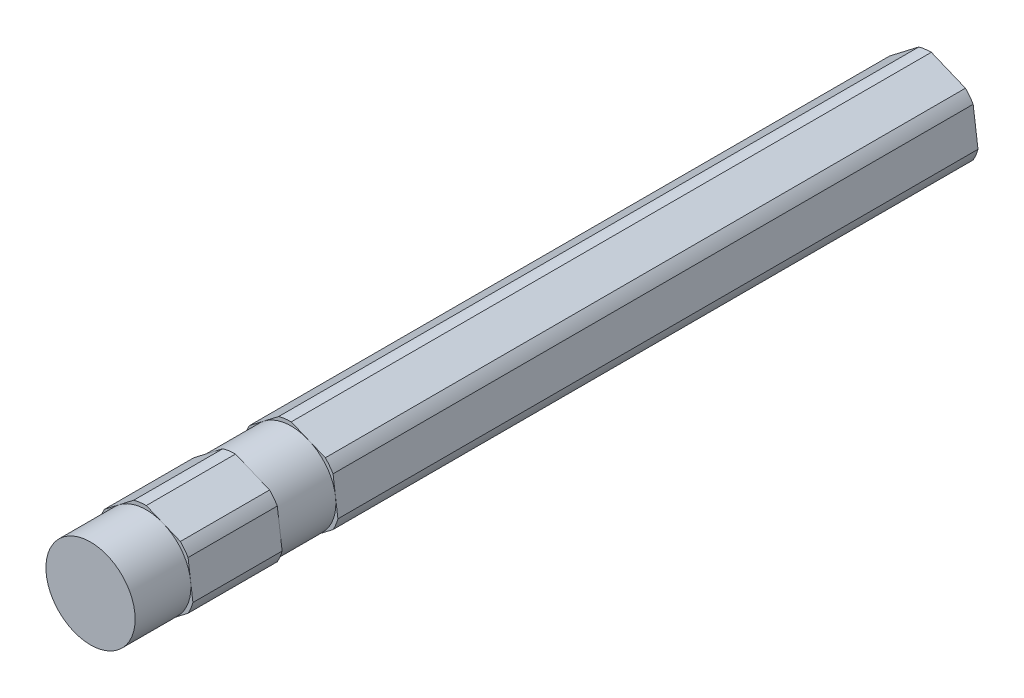
from build123d import *

# Parameters (mm, degrees)
BOSS_EXTRUDE1_DEPTH         = 119.6975
F_1_4_20_TAPPED_HOLE2_D     = 5.1054
F_1_4_20_TAPPED_HOLE2_DEPTH = 16.51
F_1_4_20_TAPPED_HOLE2_TIP   = 1.533816902
CUT_EXTRUDE1_START          = -7.9375
CUT_EXTRUDE1_DEPTH          = 7.9375
CUT_EXTRUDE3_START          = -7.9375
CUT_EXTRUDE3_DEPTH          = 7.9375


with BuildPart() as part:
    # Sketch1 → Boss-Extrude1 (new body)
    with BuildSketch(Plane.XY):
        with BuildLine():
            Line((-1.789892893, 6.63346078), (-5.950200742, 3.43535))
            ThreePointArc((-5.950200742, 3.43535), (-6.35, 2.623741315), (-6.639691997, 1.766637675))
            Line((-6.639691997, 1.766637675), (-5.950200742, -3.43535))
            ThreePointArc((-5.950200742, -3.43535), (-5.447226632, -4.187390656), (-4.849799104, -4.866823105))
            Line((-4.849799104, -4.866823105), (0, -6.8707))
            ThreePointArc((0, -6.8707), (0.902773368, -6.811131972), (1.789892893, -6.63346078))
            Line((1.789892893, -6.63346078), (5.950200742, -3.43535))
            ThreePointArc((5.950200742, -3.43535), (6.35, -2.623741315), (6.639691997, -1.766637675))
            Line((6.639691997, -1.766637675), (5.950200742, 3.43535))
            ThreePointArc((5.950200742, 3.43535), (5.447226632, 4.187390656), (4.849799104, 4.866823105))
            Line((4.849799104, 4.866823105), (0, 6.8707))
            ThreePointArc((0, 6.8707), (-0.902773368, 6.811131972), (-1.789892893, 6.63346078))
        make_face()
    extrude(amount=BOSS_EXTRUDE1_DEPTH)

    # 1/4-20 Tapped Hole2
    with Locations(Plane(origin=(0, 0, 0), x_dir=(-1, 0, 0), z_dir=(0, 0, -1))):
        with Locations((0, 0)):
            Hole(F_1_4_20_TAPPED_HOLE2_D / 2, depth=F_1_4_20_TAPPED_HOLE2_DEPTH)
            with Locations((0, 0, -(F_1_4_20_TAPPED_HOLE2_DEPTH + F_1_4_20_TAPPED_HOLE2_TIP / 2))):  # 118° drill point
                Cone(0, F_1_4_20_TAPPED_HOLE2_D / 2, F_1_4_20_TAPPED_HOLE2_TIP, mode=Mode.SUBTRACT)

    # Sketch14 → Cut-Extrude1 (cut)
    with BuildSketch(Plane.XY.offset(119.6975).offset(CUT_EXTRUDE1_START)):
        with BuildLine():
            ThreePointArc((0, 6.8707), (-0.902773368, 6.811131972), (-1.789892893, 6.63346078))
            Line((-1.789892893, 6.63346078), (-3.870046775, 5.034405422))
            ThreePointArc((-3.870046775, 5.034405422), (-0.834356092, 6.294946379), (2.424899634, 5.868761519))
            Line((2.424899634, 5.868761519), (0, 6.8707))
        make_face()
        with BuildLine():
            ThreePointArc((-6.294946365, -0.834356198), (-5.868761549, 2.42489956), (-3.870046775, 5.034405422))
            Line((-3.870046775, 5.034405422), (-5.950200742, 3.43535))
            ThreePointArc((-5.950200742, 3.43535), (-6.35, 2.623741315), (-6.639691997, 1.766637675))
            Line((-6.639691997, 1.766637675), (-6.294946365, -0.834356198))
        make_face()
        with BuildLine():
            Line((4.849799104, 4.866823105), (2.424899634, 5.868761519))
            ThreePointArc((2.424899634, 5.868761519), (5.034405431, 3.870046765), (6.294946375, 0.834356119))
            Line((6.294946375, 0.834356119), (5.950200742, 3.43535))
            ThreePointArc((5.950200742, 3.43535), (5.447226632, 4.187390656), (4.849799104, 4.866823105))
        make_face()
        with BuildLine():
            ThreePointArc((-2.424899468, -5.868761588), (-5.034405351, -3.870046868), (-6.294946365, -0.834356198))
            Line((-6.294946365, -0.834356198), (-5.950200742, -3.43535))
            ThreePointArc((-5.950200742, -3.43535), (-5.447226632, -4.187390656), (-4.849799104, -4.866823105))
            Line((-4.849799104, -4.866823105), (-2.424899468, -5.868761588))
        make_face()
        with BuildLine():
            Line((6.639691997, -1.766637675), (6.294946375, 0.834356119))
            ThreePointArc((6.294946375, 0.834356119), (5.868761562, -2.42489953), (3.870046891, -5.034405334))
            Line((3.870046891, -5.034405334), (5.950200742, -3.43535))
            ThreePointArc((5.950200742, -3.43535), (6.35, -2.623741315), (6.639691997, -1.766637675))
        make_face()
        with BuildLine():
            ThreePointArc((3.870046891, -5.034405334), (0.834356254, -6.294946357), (-2.424899468, -5.868761588))
            Line((-2.424899468, -5.868761588), (0, -6.8707))
            ThreePointArc((0, -6.8707), (0.902773368, -6.811131972), (1.789892893, -6.63346078))
            Line((1.789892893, -6.63346078), (3.870046891, -5.034405334))
        make_face()
    extrude(amount=CUT_EXTRUDE1_DEPTH, mode=Mode.SUBTRACT)

    # Sketch16 → Cut-Extrude3 (cut)
    with BuildSketch(Plane.XY.offset(99.06).offset(CUT_EXTRUDE3_START)):
        with BuildLine():
            ThreePointArc((5.950200742, 3.43535), (5.447226632, 4.187390656), (4.849799104, 4.866823105))
            Line((4.849799104, 4.866823105), (2.42489961, 5.868761529))
            ThreePointArc((2.42489961, 5.868761529), (5.034405404, 3.8700468), (6.294946367, 0.834356181))
            Line((6.294946367, 0.834356181), (5.950200742, 3.43535))
        make_face()
        with BuildLine():
            ThreePointArc((-3.870046777, 5.034405421), (-0.834356106, 6.294946377), (2.42489961, 5.868761529))
            Line((2.42489961, 5.868761529), (0, 6.8707))
            ThreePointArc((0, 6.8707), (-0.902773368, 6.811131972), (-1.789892893, 6.63346078))
            Line((-1.789892893, 6.63346078), (-3.870046777, 5.034405421))
        make_face()
        with BuildLine():
            Line((6.639691997, -1.766637675), (6.294946367, 0.834356181))
            ThreePointArc((6.294946367, 0.834356181), (5.868761553, -2.424899552), (3.870046803, -5.034405401))
            Line((3.870046803, -5.034405401), (5.950200742, -3.43535))
            ThreePointArc((5.950200742, -3.43535), (6.35, -2.623741315), (6.639691997, -1.766637675))
        make_face()
        with BuildLine():
            ThreePointArc((-6.294946361, -0.834356223), (-5.868761555, 2.424899548), (-3.870046777, 5.034405421))
            Line((-3.870046777, 5.034405421), (-5.950200742, 3.43535))
            ThreePointArc((-5.950200742, 3.43535), (-6.35, 2.623741315), (-6.639691997, 1.766637675))
            Line((-6.639691997, 1.766637675), (-6.294946361, -0.834356223))
        make_face()
        with BuildLine():
            ThreePointArc((-2.424899634, -5.868761519), (-5.034405399, -3.870046806), (-6.294946361, -0.834356223))
            Line((-6.294946361, -0.834356223), (-5.950200742, -3.43535))
            ThreePointArc((-5.950200742, -3.43535), (-5.447226632, -4.187390656), (-4.849799104, -4.866823105))
            Line((-4.849799104, -4.866823105), (-2.424899634, -5.868761519))
        make_face()
        with BuildLine():
            Line((1.789892893, -6.63346078), (3.870046803, -5.034405401))
            ThreePointArc((3.870046803, -5.034405401), (0.834356109, -6.294946376), (-2.424899634, -5.868761519))
            Line((-2.424899634, -5.868761519), (0, -6.8707))
            ThreePointArc((0, -6.8707), (0.902773368, -6.811131972), (1.789892893, -6.63346078))
        make_face()
    extrude(amount=CUT_EXTRUDE3_DEPTH, mode=Mode.SUBTRACT)


solid = part.part
